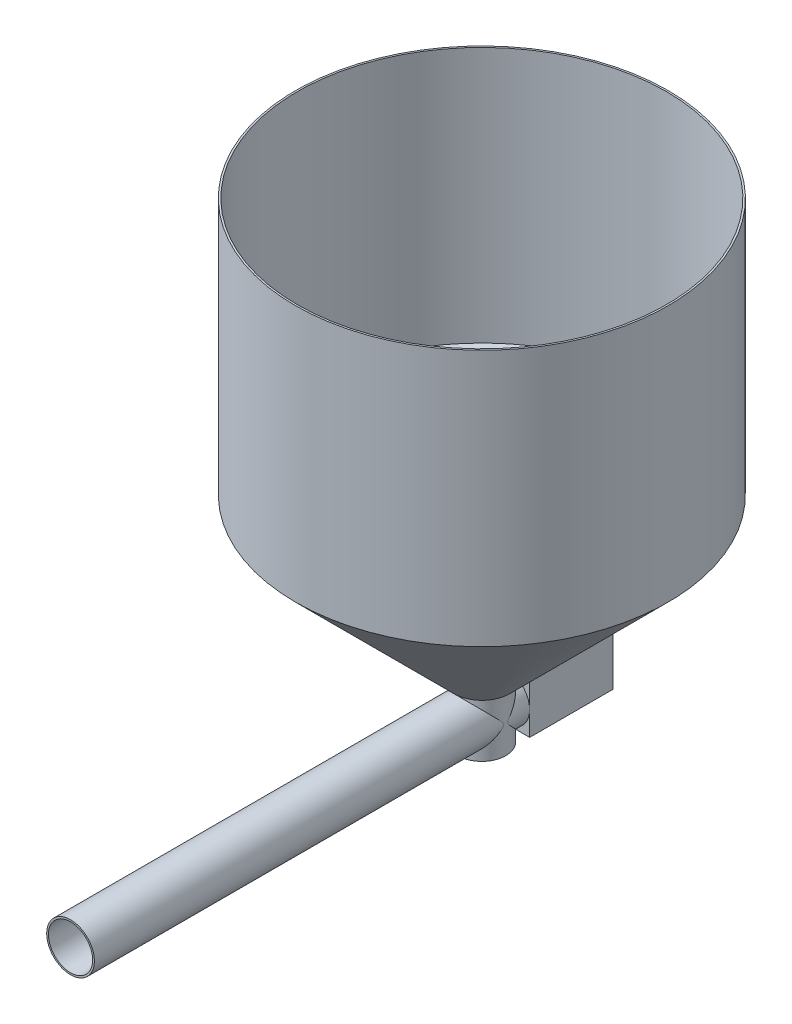
from build123d import *

# Parameters (mm, degrees)
CROQUIS1_R              = 334.8
SALIENTE_EXTRUIR1_DEPTH = 461.3
CROQUIS3_R              = 50
CROQUIS2_R              = 334.8
CROQUIS4_R              = 43
SALIENTE_EXTRUIR2_DEPTH = 100
CROQUIS5_R              = 42.86
SALIENTE_EXTRUIR3_DEPTH = 782
CROQUIS6_W              = 86
CROQUIS6_H              = 86
SALIENTE_EXTRUIR4_DEPTH = 150
VACIADO1_START          = -39.825
VACIADO1_OUTLINE_R      = 39.685
VACIADO1_DEPTH          = 778.825


with BuildPart() as part:
    # Croquis1 → Saliente-Extruir1 (new body)
    with BuildSketch(Plane(origin=(0, 0, 0), x_dir=(1, 0, 0), z_dir=(0, 1, 0))):
        with Locations(Location((0, 0, 0), (0, 0, 270))):
            Circle(CROQUIS1_R)
    extrude(amount=-SALIENTE_EXTRUIR1_DEPTH)

    # Croquis3 → Recubrir1 section 0
    with BuildSketch(Plane(origin=(0, -746.1, 0), x_dir=(1, 0, 0), z_dir=(0, 1, 0))):
        Circle(CROQUIS3_R)
    # Croquis2 → Recubrir1 section 1
    with BuildSketch(Plane.XZ.offset(461.3)):
        Circle(CROQUIS2_R)
    loft()

    # Croquis4 → Saliente-Extruir2 (add)
    with BuildSketch(Plane.XZ.offset(746.1)):
        with Locations(Location((0, 0, 0), (0, 0, 270))):
            Circle(CROQUIS4_R)
    extrude(amount=SALIENTE_EXTRUIR2_DEPTH)

    # Croquis5 → Saliente-Extruir3 (add)
    with BuildSketch(Plane(origin=(0, 0, -43), x_dir=(-1, 0, 0), z_dir=(0, 0, -1))):
        with Locations((0, -796.1)):
            Circle(CROQUIS5_R)
    extrude(amount=-SALIENTE_EXTRUIR3_DEPTH)

    # Vaciado1: read off the stored shape, not the designer's step
    # Vaciado1 outline → Vaciado1 (cut)
    with BuildSketch(Plane.XY.offset(VACIADO1_START)):
        with Locations((0, -796.1)):
            Circle(VACIADO1_OUTLINE_R)
    extrude(amount=VACIADO1_DEPTH, mode=Mode.SUBTRACT)

    # Vaciado1 2 outline → Vaciado1 2 (revolve, cut)
    with BuildSketch(Plane.XY):
        Polygon((48.684871939, -742.925), (331.625, -459.984871939), (331.625, 0), (0, 0), (0, -842.925), (39.825, -842.925), (39.825, -742.925), align=None)
    revolve(axis=Axis((0, 0, 0), (0, 1, 0)), mode=Mode.SUBTRACT)


with BuildPart() as body_2:
    # Croquis6 → Saliente-Extruir4 (new body)
    with BuildSketch(Plane(origin=(0, 0, -43), x_dir=(-1, 0, 0), z_dir=(0, 0, -1))):
        with Locations((0, -796.1)):
            Rectangle(CROQUIS6_W, CROQUIS6_H)
    extrude(amount=SALIENTE_EXTRUIR4_DEPTH)


solid = Compound([part.part, body_2.part])
